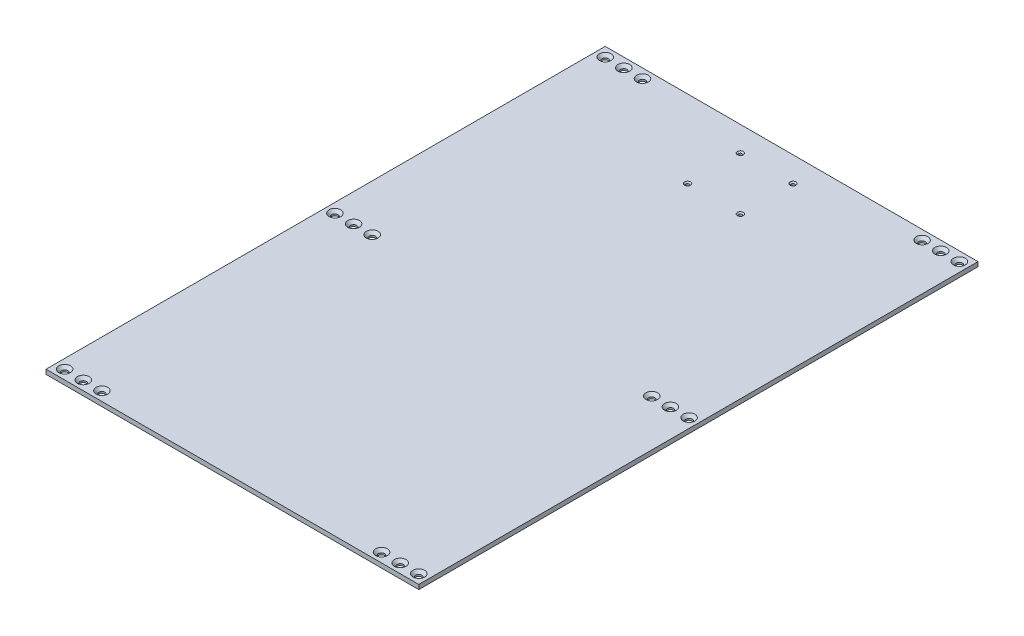
from build123d import *

# Parameters (mm, degrees)
SKETCH1_W                                       = 400
SKETCH1_H                                       = 600
BOSS_EXTRUDE1_DEPTH                             = 4.826
CSK_FOR_M6_FLAT_HEAD_MACHINE_SCREW1_AT_2_COUNT  = 2
CSK_FOR_M6_FLAT_HEAD_MACHINE_SCREW1_AT_2_PITCH  = 290
CSK_FOR_M6_FLAT_HEAD_MACHINE_SCREW1_AT_3_COUNT  = 2
CSK_FOR_M6_FLAT_HEAD_MACHINE_SCREW1_AT_3_PITCH  = 580
CSK_FOR_M6_FLAT_HEAD_MACHINE_SCREW1_AT_4_COUNT  = 2
CSK_FOR_M6_FLAT_HEAD_MACHINE_SCREW1_AT_4_PITCH  = 693.397432934
CSK_FOR_M6_FLAT_HEAD_MACHINE_SCREW1_AT_5_COUNT  = 2
CSK_FOR_M6_FLAT_HEAD_MACHINE_SCREW1_AT_5_PITCH  = 478.016736109
CSK_FOR_M6_FLAT_HEAD_MACHINE_SCREW1_AT_6_COUNT  = 2
CSK_FOR_M6_FLAT_HEAD_MACHINE_SCREW1_AT_6_PITCH  = 380
CSK_FOR_M6_FLAT_HEAD_MACHINE_SCREW2_AT_2_COUNT  = 2
CSK_FOR_M6_FLAT_HEAD_MACHINE_SCREW2_AT_2_PITCH  = 20
CSK_FOR_M6_FLAT_HEAD_MACHINE_SCREW2_AT_3_COUNT  = 2
CSK_FOR_M6_FLAT_HEAD_MACHINE_SCREW2_AT_3_PITCH  = 290
CSK_FOR_M6_FLAT_HEAD_MACHINE_SCREW2_AT_4_COUNT  = 2
CSK_FOR_M6_FLAT_HEAD_MACHINE_SCREW2_AT_4_PITCH  = 290.688837075
CSK_FOR_M6_FLAT_HEAD_MACHINE_SCREW2_AT_5_COUNT  = 2
CSK_FOR_M6_FLAT_HEAD_MACHINE_SCREW2_AT_5_PITCH  = 580
CSK_FOR_M6_FLAT_HEAD_MACHINE_SCREW2_AT_6_COUNT  = 2
CSK_FOR_M6_FLAT_HEAD_MACHINE_SCREW2_AT_6_PITCH  = 580.344725142
CSK_FOR_M6_FLAT_HEAD_MACHINE_SCREW2_AT_7_COUNT  = 2
CSK_FOR_M6_FLAT_HEAD_MACHINE_SCREW2_AT_7_PITCH  = 672.309452559
CSK_FOR_M6_FLAT_HEAD_MACHINE_SCREW2_AT_8_COUNT  = 2
CSK_FOR_M6_FLAT_HEAD_MACHINE_SCREW2_AT_8_PITCH  = 662.419806467
CSK_FOR_M6_FLAT_HEAD_MACHINE_SCREW2_AT_9_COUNT  = 2
CSK_FOR_M6_FLAT_HEAD_MACHINE_SCREW2_AT_9_PITCH  = 446.87805943
CSK_FOR_M6_FLAT_HEAD_MACHINE_SCREW2_AT_1_COUNT  = 2
CSK_FOR_M6_FLAT_HEAD_MACHINE_SCREW2_AT_1_PITCH  = 431.856457634
CSK_FOR_M6_FLAT_HEAD_MACHINE_SCREW2_2_COUNT     = 2
CSK_FOR_M6_FLAT_HEAD_MACHINE_SCREW2_2_PITCH     = 340
CSK_FOR_M6_FLAT_HEAD_MACHINE_SCREW2_3_COUNT     = 2
CSK_FOR_M6_FLAT_HEAD_MACHINE_SCREW2_3_PITCH     = 320
CSK_FOR_M3_FLAT_HEAD_MACHINE_SCREW1_D           = 3.6
CSK_FOR_M3_FLAT_HEAD_MACHINE_SCREW1_CSINK_D     = 6.3
CSK_FOR_M3_FLAT_HEAD_MACHINE_SCREW1_CSINK_ANGLE = 90


with BuildPart() as part:
    # Sketch1 → Boss-Extrude1 (new body)
    with BuildSketch(Plane(origin=(0, 0, 0), x_dir=(1, 0, 0), z_dir=(0, 1, 0))):
        with Locations((200, -300)):
            Rectangle(SKETCH1_W, SKETCH1_H)
    extrude(amount=BOSS_EXTRUDE1_DEPTH)

    # Sketch6 → CSK for M6 Flat Head Machine Screw1 (revolve, cut)
    with BuildSketch(Plane(origin=(10, 4.826, 10), x_dir=(0, 0, 1), z_dir=(1, 0, 0))):
        Polygon((0, 0), (0, 4.826), (3.3, 4.826), (3.3, 3), (6.3, 0), align=None)
    csk_for_m6_flat_head_machine_screw1 = revolve(axis=Axis((10, 11.176, 10), (0, -1, 0)), mode=Mode.SUBTRACT)

    # CSK for M6 Flat Head Machine Screw1 at 2: CSK for M6 Flat Head Machine Screw1 ×2
    with Locations(*[(0, 0, i * CSK_FOR_M6_FLAT_HEAD_MACHINE_SCREW1_AT_2_PITCH) for i in range(1, CSK_FOR_M6_FLAT_HEAD_MACHINE_SCREW1_AT_2_COUNT)]):
        add(csk_for_m6_flat_head_machine_screw1, mode=Mode.SUBTRACT)

    # CSK for M6 Flat Head Machine Screw1 at 3: CSK for M6 Flat Head Machine Screw1 ×2
    with Locations(*[(0, 0, i * CSK_FOR_M6_FLAT_HEAD_MACHINE_SCREW1_AT_3_PITCH) for i in range(1, CSK_FOR_M6_FLAT_HEAD_MACHINE_SCREW1_AT_3_COUNT)]):
        add(csk_for_m6_flat_head_machine_screw1, mode=Mode.SUBTRACT)

    # CSK for M6 Flat Head Machine Screw1 at 4: CSK for M6 Flat Head Machine Screw1 ×2
    with Locations(*[Vector(0.5480262573108731, 0, 0.8364611295797533) * (i * CSK_FOR_M6_FLAT_HEAD_MACHINE_SCREW1_AT_4_PITCH) for i in range(1, CSK_FOR_M6_FLAT_HEAD_MACHINE_SCREW1_AT_4_COUNT)]):
        add(csk_for_m6_flat_head_machine_screw1, mode=Mode.SUBTRACT)

    # CSK for M6 Flat Head Machine Screw1 at 5: CSK for M6 Flat Head Machine Screw1 ×2
    with Locations(*[Vector(0.7949512460450776, 0, 0.6066733193501909) * (i * CSK_FOR_M6_FLAT_HEAD_MACHINE_SCREW1_AT_5_PITCH) for i in range(1, CSK_FOR_M6_FLAT_HEAD_MACHINE_SCREW1_AT_5_COUNT)]):
        add(csk_for_m6_flat_head_machine_screw1, mode=Mode.SUBTRACT)

    # CSK for M6 Flat Head Machine Screw1 at 6: CSK for M6 Flat Head Machine Screw1 ×2
    with Locations(*[(i * CSK_FOR_M6_FLAT_HEAD_MACHINE_SCREW1_AT_6_PITCH, 0, 0) for i in range(1, CSK_FOR_M6_FLAT_HEAD_MACHINE_SCREW1_AT_6_COUNT)]):
        add(csk_for_m6_flat_head_machine_screw1, mode=Mode.SUBTRACT)

    # Sketch8 → CSK for M6 Flat Head Machine Screw2 (revolve, cut)
    with BuildSketch(Plane(origin=(370, 4.826, 10), x_dir=(0, 0, 1), z_dir=(1, 0, 0))):
        Polygon((0, 0), (0, 4.826), (3.3, 4.826), (3.3, 3), (6.3, 0), align=None)
    csk_for_m6_flat_head_machine_screw2 = revolve(axis=Axis((370, 11.176, 10), (0, -1, 0)), mode=Mode.SUBTRACT)

    # CSK for M6 Flat Head Machine Screw2 at 2: CSK for M6 Flat Head Machine Screw2 ×2
    with Locations(*[(-i * CSK_FOR_M6_FLAT_HEAD_MACHINE_SCREW2_AT_2_PITCH, 0, 0) for i in range(1, CSK_FOR_M6_FLAT_HEAD_MACHINE_SCREW2_AT_2_COUNT)]):
        add(csk_for_m6_flat_head_machine_screw2, mode=Mode.SUBTRACT)

    # CSK for M6 Flat Head Machine Screw2 at 3: CSK for M6 Flat Head Machine Screw2 ×2
    with Locations(*[(0, 0, i * CSK_FOR_M6_FLAT_HEAD_MACHINE_SCREW2_AT_3_PITCH) for i in range(1, CSK_FOR_M6_FLAT_HEAD_MACHINE_SCREW2_AT_3_COUNT)]):
        add(csk_for_m6_flat_head_machine_screw2, mode=Mode.SUBTRACT)

    # CSK for M6 Flat Head Machine Screw2 at 4: CSK for M6 Flat Head Machine Screw2 ×2
    with Locations(*[Vector(-0.06880209161537774, 0, 0.9976303284229832) * (i * CSK_FOR_M6_FLAT_HEAD_MACHINE_SCREW2_AT_4_PITCH) for i in range(1, CSK_FOR_M6_FLAT_HEAD_MACHINE_SCREW2_AT_4_COUNT)]):
        add(csk_for_m6_flat_head_machine_screw2, mode=Mode.SUBTRACT)

    # CSK for M6 Flat Head Machine Screw2 at 5: CSK for M6 Flat Head Machine Screw2 ×2
    with Locations(*[(0, 0, i * CSK_FOR_M6_FLAT_HEAD_MACHINE_SCREW2_AT_5_PITCH) for i in range(1, CSK_FOR_M6_FLAT_HEAD_MACHINE_SCREW2_AT_5_COUNT)]):
        add(csk_for_m6_flat_head_machine_screw2, mode=Mode.SUBTRACT)

    # CSK for M6 Flat Head Machine Screw2 at 6: CSK for M6 Flat Head Machine Screw2 ×2
    with Locations(*[Vector(-0.03446227583977849, 0, 0.9994059993535875) * (i * CSK_FOR_M6_FLAT_HEAD_MACHINE_SCREW2_AT_6_PITCH) for i in range(1, CSK_FOR_M6_FLAT_HEAD_MACHINE_SCREW2_AT_6_COUNT)]):
        add(csk_for_m6_flat_head_machine_screw2, mode=Mode.SUBTRACT)

    # CSK for M6 Flat Head Machine Screw2 at 7: CSK for M6 Flat Head Machine Screw2 ×2
    with Locations(*[Vector(-0.5057194997124201, 0, 0.8626979700976579) * (i * CSK_FOR_M6_FLAT_HEAD_MACHINE_SCREW2_AT_7_PITCH) for i in range(1, CSK_FOR_M6_FLAT_HEAD_MACHINE_SCREW2_AT_7_COUNT)]):
        add(csk_for_m6_flat_head_machine_screw2, mode=Mode.SUBTRACT)

    # CSK for M6 Flat Head Machine Screw2 at 8: CSK for M6 Flat Head Machine Screw2 ×2
    with Locations(*[Vector(-0.48307734291133475, 0, 0.8755776840267943) * (i * CSK_FOR_M6_FLAT_HEAD_MACHINE_SCREW2_AT_8_PITCH) for i in range(1, CSK_FOR_M6_FLAT_HEAD_MACHINE_SCREW2_AT_8_COUNT)]):
        add(csk_for_m6_flat_head_machine_screw2, mode=Mode.SUBTRACT)

    # CSK for M6 Flat Head Machine Screw2 at 9: CSK for M6 Flat Head Machine Screw2 ×2
    with Locations(*[Vector(-0.7608339519590858, 0, 0.6489466060827498) * (i * CSK_FOR_M6_FLAT_HEAD_MACHINE_SCREW2_AT_9_PITCH) for i in range(1, CSK_FOR_M6_FLAT_HEAD_MACHINE_SCREW2_AT_9_COUNT)]):
        add(csk_for_m6_flat_head_machine_screw2, mode=Mode.SUBTRACT)

    # CSK for M6 Flat Head Machine Screw2 at 1: CSK for M6 Flat Head Machine Screw2 ×2
    with Locations(*[Vector(-0.7409869514359826, 0, 0.6715194247388595) * (i * CSK_FOR_M6_FLAT_HEAD_MACHINE_SCREW2_AT_1_PITCH) for i in range(1, CSK_FOR_M6_FLAT_HEAD_MACHINE_SCREW2_AT_1_COUNT)]):
        add(csk_for_m6_flat_head_machine_screw2, mode=Mode.SUBTRACT)

    # CSK for M6 Flat Head Machine Screw2  2: CSK for M6 Flat Head Machine Screw2 ×2
    with Locations(*[(-i * CSK_FOR_M6_FLAT_HEAD_MACHINE_SCREW2_2_PITCH, 0, 0) for i in range(1, CSK_FOR_M6_FLAT_HEAD_MACHINE_SCREW2_2_COUNT)]):
        add(csk_for_m6_flat_head_machine_screw2, mode=Mode.SUBTRACT)

    # CSK for M6 Flat Head Machine Screw2  3: CSK for M6 Flat Head Machine Screw2 ×2
    with Locations(*[(-i * CSK_FOR_M6_FLAT_HEAD_MACHINE_SCREW2_3_PITCH, 0, 0) for i in range(1, CSK_FOR_M6_FLAT_HEAD_MACHINE_SCREW2_3_COUNT)]):
        add(csk_for_m6_flat_head_machine_screw2, mode=Mode.SUBTRACT)

    # CSK for M3 Flat Head Machine Screw1 (through all)
    with Locations(Plane(origin=(0, 4.826, 0), x_dir=(1, 0, 0), z_dir=(0, 1, 0))):
        with Locations((171.715728753, -26.715728753), (228.284271247, -26.715728753), (228.284271247, -83.284271247), (171.715728753, -83.284271247)):
            CounterSinkHole(CSK_FOR_M3_FLAT_HEAD_MACHINE_SCREW1_D / 2, CSK_FOR_M3_FLAT_HEAD_MACHINE_SCREW1_CSINK_D / 2, counter_sink_angle=CSK_FOR_M3_FLAT_HEAD_MACHINE_SCREW1_CSINK_ANGLE)


solid = part.part
